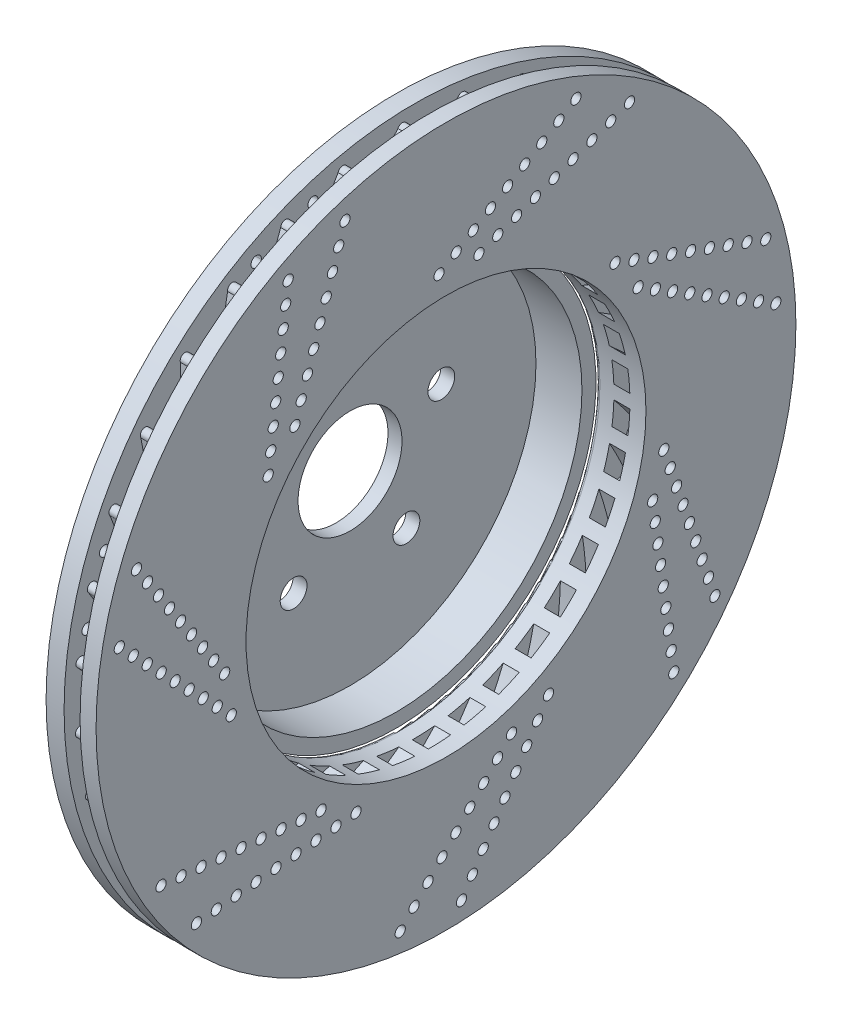
from build123d import *

# Parameters (mm, degrees)
SKETCH2_R           = 87.5
BOSS_EXTRUDE1_DEPTH = 4.5
SKETCH3_R           = 50
CUT_EXTRUDE1_DEPTH  = 124.82548203
SKETCH4_R           = 1.28
CUT_EXTRUDE6_DEPTH  = 124.82548203
CIRPATTERN1_COUNT   = 7
SKETCH6_R           = 87.5
SKETCH6_R_2         = 50
BOSS_EXTRUDE2_DEPTH = 4
SKETCH7_R           = 1.28
CUT_EXTRUDE8_DEPTH  = 13
CIRPATTERN3_COUNT   = 7
BOSS_EXTRUDE3_DEPTH = 7
SKETCH11_R          = 50
BOSS_EXTRUDE4_DEPTH = 15
SHELL1_T            = -3.5
FILLET1_R           = 1
SKETCH12_R          = 13
SKETCH12_R_2        = 3.35
CUT_EXTRUDE9_DEPTH  = 15


with BuildPart() as part:
    # Sketch2 → Boss-Extrude1 (new body)
    with BuildSketch(Plane(origin=(0, 0, 0), x_dir=(0, 0, -1), z_dir=(1, 0, 0))):
        Circle(SKETCH2_R)
    extrude(amount=BOSS_EXTRUDE1_DEPTH)

    # Sketch3 → Cut-Extrude1 (cut, through all)
    with BuildSketch(Plane(origin=(4.5, 0, 0), x_dir=(0, 0, -1), z_dir=(1, 0, 0))):
        Circle(SKETCH3_R)
    extrude(amount=-CUT_EXTRUDE1_DEPTH, mode=Mode.SUBTRACT)

    # Sketch4 → Cut-Extrude6 (cut, through all)
    with BuildSketch(Plane(origin=(4.5, 0, 0), x_dir=(0, 0, -1), z_dir=(1, 0, 0))):
        with Locations((-36.238967636, -45.409652022)):
            Circle(SKETCH4_R)
        with Locations((-31.238967636, -45.873487998)):
            Circle(SKETCH4_R)
        with Locations((-41.238967636, -44.945816046)):
            Circle(SKETCH4_R)
        with Locations((-46.238967636, -44.48198007)):
            Circle(SKETCH4_R)
        with Locations((-51.217591126, -44.020127132)):
            Circle(SKETCH4_R)
        with Locations((-56.217591126, -43.556291156)):
            Circle(SKETCH4_R)
        with Locations((-66.217591126, -42.628619204)):
            Circle(SKETCH4_R)
        with Locations((-61.217591126, -43.09245518)):
            Circle(SKETCH4_R)
        with Locations((-62.5, -54.727134355)):
            Circle(SKETCH4_R)
        with Locations((-57.5, -54.228068007)):
            Circle(SKETCH4_R)
        with Locations((-52.5, -53.72900166)):
            Circle(SKETCH4_R)
        with Locations((-47.5, -53.229935313)):
            Circle(SKETCH4_R)
        with Locations((-42.5, -52.730868965)):
            Circle(SKETCH4_R)
        with Locations((-37.5, -52.231802618)):
            Circle(SKETCH4_R)
        with Locations((-32.5, -51.732736271)):
            Circle(SKETCH4_R)
        with Locations((-27.5, -51.233669923)):
            Circle(SKETCH4_R)
        with Locations((-22.5, -50.734603576)):
            Circle(SKETCH4_R)
    cut_extrude6 = extrude(amount=-CUT_EXTRUDE6_DEPTH, mode=Mode.SUBTRACT)

    # CirPattern1: Cut-Extrude6 ×7 about axis
    cirpattern1_axis = Axis((0, 0, 0), (1, 0, 0))
    for i in range(1, CIRPATTERN1_COUNT):
        add(cut_extrude6.rotate(cirpattern1_axis, i * 360 / CIRPATTERN1_COUNT), mode=Mode.SUBTRACT)


with BuildPart() as body_2:
    # Sketch6 → Boss-Extrude2 (new body)
    with BuildSketch(Plane(origin=(8.5, 0, 0), x_dir=(0, 0, -1), z_dir=(1, 0, 0))):
        Circle(SKETCH6_R)
        Circle(SKETCH6_R_2, mode=Mode.SUBTRACT)
    extrude(amount=BOSS_EXTRUDE2_DEPTH)


with BuildPart() as cut_extrude8_tool:
    # Sketch7 → Cut-Extrude8 (new body)
    with BuildSketch(Plane(origin=(12.5, 0, 0), x_dir=(0, 0, -1), z_dir=(1, 0, 0))):
        with Locations((-71.238967636, -42.162800189)):
            Circle(SKETCH7_R)
        with Locations((-66.238967636, -42.626636165)):
            Circle(SKETCH7_R)
        with Locations((-61.238967636, -43.090472141)):
            Circle(SKETCH7_R)
        with Locations((-56.238967636, -43.554308117)):
            Circle(SKETCH7_R)
        with Locations((-51.238967636, -44.018144094)):
            Circle(SKETCH7_R)
        with Locations((-46.238967636, -44.48198007)):
            Circle(SKETCH7_R)
        with Locations((-41.238967636, -44.945816046)):
            Circle(SKETCH7_R)
        with Locations((-36.238967636, -45.409652022)):
            Circle(SKETCH7_R)
        with Locations((-31.238967636, -45.873487998)):
            Circle(SKETCH7_R)
        with Locations((-27.5, -51.233669923)):
            Circle(SKETCH7_R)
        with Locations((-32.5, -51.732736271)):
            Circle(SKETCH7_R)
        with Locations((-37.5, -52.231802618)):
            Circle(SKETCH7_R)
        with Locations((-47.47527785, -53.227467714)):
            Circle(SKETCH7_R)
        with Locations((-52.4505557, -53.724066463)):
            Circle(SKETCH7_R)
        with Locations((-57.425833549, -54.220665211)):
            Circle(SKETCH7_R)
        with Locations((-62.401111399, -54.71726396)):
            Circle(SKETCH7_R)
        with Locations((-22.5, -50.734603576)):
            Circle(SKETCH7_R)
        with Locations((-42.5, -52.730868965)):
            Circle(SKETCH7_R)
    cut_extrude8 = extrude(amount=-CUT_EXTRUDE8_DEPTH)


with BuildPart() as part_1:
    add(part.part)

    # Cut-Extrude8: cut by cut_extrude8_tool
    add(cut_extrude8_tool.part, mode=Mode.SUBTRACT)


with BuildPart() as body_2_1:
    add(body_2.part)

    # Cut-Extrude8: cut by cut_extrude8_tool
    add(cut_extrude8_tool.part, mode=Mode.SUBTRACT)


with BuildPart() as cirpattern3_tool:
    # CirPattern3: Cut-Extrude8 ×7 about axis
    cirpattern3_axis = Axis((0, 0, 0), (1, 0, 0))
    for i in range(1, CIRPATTERN3_COUNT):
        add(cut_extrude8.rotate(cirpattern3_axis, i * 360 / CIRPATTERN3_COUNT))


with BuildPart() as part_2:
    add(part_1.part)

    # CirPattern3: cut by cirpattern3_tool
    add(cirpattern3_tool.part, mode=Mode.SUBTRACT)



with BuildPart() as body_2_2:
    add(body_2_1.part)

    # CirPattern3: cut by cirpattern3_tool
    add(cirpattern3_tool.part, mode=Mode.SUBTRACT)


with BuildPart() as part_3:
    add(part_2.part)

    add(body_2_2.part)  # Boss-Extrude3 merges body 2
    # Sketch9 → Boss-Extrude3 (add)
    with BuildSketch(Plane.ZY.offset(-8.5)):
        with BuildLine():
            ThreePointArc((68.442168795, -47.350174225), (69.422712349, -48.739933197), (68.032953377, -49.720476751))
            add(Edge.make_bspline(
                [(17.953456701, -46.665548239), (42.503233131, -53.510207184), (68.032953377, -49.720476751)],
                knots=[0, 0, 0, 1, 1, 1], degree=2))
            ThreePointArc((17.953456701, -46.665548239), (19.526266784, -46.029609009), (21.076597054, -45.340677726))
            add(Edge.make_bspline(
                [(21.076597054, -45.340677726), (44.378084471, -52.109699667), (68.442168795, -47.350174225)],
                knots=[0, 0, 0, 1, 1, 1], degree=2))
        make_face()
        with BuildLine():
            ThreePointArc((9.332481879, -49.12132716), (10.99356759, -48.776443819), (12.641996845, -48.375406104))
            add(Edge.make_bspline(
                [(12.641996845, -48.375406104), (34.360364234, -59.196288315), (58.887574908, -58.810058579)],
                knots=[0, 0, 0, 1, 1, 1], degree=2))
            ThreePointArc((58.887574908, -58.810058579), (59.604209677, -60.352566364), (58.061701891, -61.069201133))
            add(Edge.make_bspline(
                [(9.332481879, -49.12132716), (32.265572254, -60.239521467), (58.061701891, -61.069201133)],
                knots=[0, 0, 0, 1, 1, 1], degree=2))
        make_face()
        with BuildLine():
            ThreePointArc((0.411553409, -49.998306209), (2.107526088, -49.955563592), (3.801072456, -49.855309127))
            add(Edge.make_bspline(
                [(3.801072456, -49.855309127), (23.23827362, -64.380259551), (47.44028591, -68.379739261)],
                knots=[0, 0, 0, 1, 1, 1], degree=2))
            ThreePointArc((47.44028591, -68.379739261), (47.869978663, -70.025418391), (46.224299533, -70.455111144))
            add(Edge.make_bspline(
                [(0.411553409, -49.998306209), (20.990869336, -65.032687965), (46.224299533, -70.455111144)],
                knots=[0, 0, 0, 1, 1, 1], degree=2))
        make_face()
        with BuildLine():
            ThreePointArc((-8.522602725, -49.268298558), (-6.846253036, -49.529070447), (-5.162021529, -49.732821494))
            add(Edge.make_bspline(
                [(-5.162021529, -49.732821494), (11.369285771, -67.494996272), (34.468227089, -75.75163886)],
                knots=[0, 0, 0, 1, 1, 1], degree=2))
            ThreePointArc((34.468227089, -75.75163886), (34.597167147, -77.447595853), (32.901210154, -77.576535911))
            add(Edge.make_bspline(
                [(-8.522602725, -49.268298558), (9.041502607, -67.735650363), (32.901210154, -77.576535911)],
                knots=[0, 0, 0, 1, 1, 1], degree=2))
        make_face()
        with BuildLine():
            ThreePointArc((-17.182835396, -46.954767253), (-15.579987954, -47.510672226), (-13.959203895, -48.011880057))
            add(Edge.make_bspline(
                [(-13.959203895, -48.011880057), (-0.865120277, -68.440388277), (20.388331088, -80.688818457)],
                knots=[0, 0, 0, 1, 1, 1], degree=2))
            ThreePointArc((20.388331088, -80.688818457), (20.212374213, -82.38054386), (18.52064881, -82.204586984))
            add(Edge.make_bspline(
                [(-17.182835396, -46.954767253), (-3.198465456, -68.261533225), (18.52064881, -82.204586984)],
                knots=[0, 0, 0, 1, 1, 1], degree=2))
        make_face()
        with BuildLine():
            ThreePointArc((-25.290797599, -43.132071094), (-23.812969241, -43.965241907), (-22.307725962, -44.747797291))
            add(Edge.make_bspline(
                [(-22.307725962, -44.747797291), (-13.071720648, -67.186049891), (5.653137351, -83.032593038)],
                knots=[0, 0, 0, 1, 1, 1], degree=2))
            ThreePointArc((5.653137351, -83.032593038), (5.17793894, -84.665713405), (3.544818574, -84.190514993))
            add(Edge.make_bspline(
                [(-25.290797599, -43.132071094), (-15.335632207, -66.593434243), (3.544818574, -84.190514993)],
                knots=[0, 0, 0, 1, 1, 1], degree=2))
        make_face()
        with BuildLine():
            ThreePointArc((-32.585892757, -37.92307468), (-31.280582102, -39.006732539), (-29.939259361, -40.045483502))
            add(Edge.make_bspline(
                [(-29.939259361, -40.045483502), (-24.858185162, -63.77229658), (-9.263752872, -82.70763176)],
                knots=[0, 0, 0, 1, 1, 1], degree=2))
            ThreePointArc((-9.263752872, -82.70763176), (-10.02291955, -84.229657257), (-11.544945047, -83.470490578))
            add(Edge.make_bspline(
                [(-32.585892757, -37.92307468), (-26.979899121, -62.784967492), (-11.544945047, -83.470490578)],
                knots=[0, 0, 0, 1, 1, 1], degree=2))
        make_face()
        with BuildLine():
            ThreePointArc((-38.833650511, -31.495199444), (-37.742811317, -32.794514692), (-36.608520331, -34.056074923))
            add(Edge.make_bspline(
                [(-36.608520331, -34.056074923), (-35.845687151, -58.308849185), (-23.882898455, -79.724379145)],
                knots=[0, 0, 0, 1, 1, 1], degree=2))
            ThreePointArc((-23.882898455, -79.724379145), (-24.901633159, -81.086390621), (-26.263644636, -80.067655917))
            add(Edge.make_bspline(
                [(-38.833650511, -31.495199444), (-37.757009878, -56.958540225), (-26.263644636, -80.067655917)],
                knots=[0, 0, 0, 1, 1, 1], degree=2))
        make_face()
        with BuildLine():
            ThreePointArc((-43.833262785, -24.055042583), (-42.991955522, -25.528254159), (-42.101153336, -26.972076075))
            add(Edge.make_bspline(
                [(-42.101153336, -26.972076075), (-45.681079262, -50.971307401), (-37.734428031, -74.178719386)],
                knots=[0, 0, 0, 1, 1, 1], degree=2))
            ThreePointArc((-37.734428031, -74.178719386), (-38.97998779, -75.336940672), (-40.138209076, -74.091380914))
            add(Edge.make_bspline(
                [(-43.833262785, -24.055042583), (-47.32057927, -49.301418611), (-40.138209076, -74.091380914)],
                knots=[0, 0, 0, 1, 1, 1], degree=2))
        make_face()
        with BuildLine():
            ThreePointArc((-47.424037926, -15.84173686), (-46.859302902, -17.441494533), (-46.240620632, -19.021172509))
            add(Edge.make_bspline(
                [(-46.240620632, -19.021172509), (-54.048243898, -41.995505857), (-50.373142042, -66.248894552)],
                knots=[0, 0, 0, 1, 1, 1], degree=2))
            ThreePointArc((-50.373142042, -66.248894552), (-51.80549354, -67.166099463), (-52.722698451, -65.733747966))
            add(Edge.make_bspline(
                [(-47.424037926, -15.84173686), (-55.36322631, -40.059708836), (-52.722698451, -65.733747966)],
                knots=[0, 0, 0, 1, 1, 1], degree=2))
        make_face()
        with BuildLine():
            ThreePointArc((-49.490565469, -7.119264681), (-49.220553731, -8.794150922), (-48.893876333, -10.458912808))
            add(Edge.make_bspline(
                [(-48.893876333, -10.458912808), (-60.678253504, -31.669934201), (-61.392821821, -56.189775737)],
                knots=[0, 0, 0, 1, 1, 1], degree=2))
            ThreePointArc((-61.392821821, -56.189775737), (-62.965928101, -56.836484553), (-63.612636917, -55.263378272))
            add(Edge.make_bspline(
                [(-49.490565469, -7.119264681), (-61.626453703, -29.530447059), (-63.612636917, -55.263378272)],
                knots=[0, 0, 0, 1, 1, 1], degree=2))
        make_face()
        with BuildLine():
            ThreePointArc((-49.966425516, 1.832026524), (-49.999815464, 0.135843936), (-49.975642619, -1.560495043))
            add(Edge.make_bspline(
                [(-49.975642619, -1.560495043), (-65.358014117, -20.326464802), (-70.439285793, -44.324671297)],
                knots=[0, 0, 0, 1, 1, 1], degree=2))
            ThreePointArc((-70.439285793, -44.324671297), (-72.102585926, -44.680098263), (-72.458012891, -43.01679813))
            add(Edge.make_bspline(
                [(-49.966425516, 1.832026524), (-65.908956168, -18.052052415), (-72.458012891, -43.01679813)],
                knots=[0, 0, 0, 1, 1, 1], degree=2))
        make_face()
        with BuildLine():
            ThreePointArc((-48.836323534, 10.724434888), (-49.172041988, 9.061472658), (-49.451150632, 7.388078316))
            add(Edge.make_bspline(
                [(-49.451150632, 7.388078316), (-67.937114379, -8.3296861), (-77.221773161, -31.034935451)],
                knots=[0, 0, 0, 1, 1, 1], degree=2))
            ThreePointArc((-77.221773161, -31.034935451), (-78.921807312, -31.087656853), (-78.974528713, -29.387622702))
            add(Edge.make_bspline(
                [(-48.836323534, 10.724434888), (-68.073090551, -5.993449953), (-78.974528713, -29.387622702)],
                knots=[0, 0, 0, 1, 1, 1], degree=2))
        make_face()
        with BuildLine():
            ThreePointArc((-46.136581932, 19.272151091), (-46.763838624, 17.695858193), (-47.337257974, 16.099192759))
            add(Edge.make_bspline(
                [(-47.337257974, 16.099192759), (-68.332659886, 3.934815568), (-81.522289202, -16.747711244)],
                knots=[0, 0, 0, 1, 1, 1], degree=2))
            ThreePointArc((-81.522289202, -16.747711244), (-83.204416874, -16.496032572), (-82.952738202, -14.8139049))
            add(Edge.make_bspline(
                [(-46.136581932, 19.272151091), (-68.049299793, 6.257786921), (-82.952738202, -14.8139049)],
                knots=[0, 0, 0, 1, 1, 1], degree=2))
        make_face()
        with BuildLine():
            ThreePointArc((-41.953972624, 27.200444501), (-42.852607009, 25.761484285), (-43.701906896, 24.2928659))
            add(Edge.make_bspline(
                [(-43.701906896, 24.2928659), (-66.53193748, 16.072849026), (-83.202611791, -1.922201818)],
                knots=[0, 0, 0, 1, 1, 1], degree=2))
            ThreePointArc((-83.202611791, -1.922201818), (-84.812768017, -1.374212232), (-84.264778431, 0.235943995))
            add(Edge.make_bspline(
                [(-41.953972624, 27.200444501), (-65.838348549, 18.307893375), (-84.264778431, 0.235943995)],
                knots=[0, 0, 0, 1, 1, 1], degree=2))
        make_face()
        with BuildLine():
            ThreePointArc((-36.422928117, 34.254493243), (-37.564057345, 32.999115076), (-38.661940573, 31.705746343))
            add(Edge.make_bspline(
                [(-38.661940573, 31.705746343), (-62.592823861, 27.694287891), (-82.208733977, 12.965088756)],
                knots=[0, 0, 0, 1, 1, 1], degree=2))
            ThreePointArc((-82.208733977, 12.965088756), (-83.695167012, 13.79177642), (-82.868479348, 15.278209455))
            add(Edge.make_bspline(
                [(-36.422928117, 34.254493243), (-61.51129861, 29.769569073), (-82.868479348, 15.278209455)],
                knots=[0, 0, 0, 1, 1, 1], degree=2))
        make_face()
        with BuildLine():
            ThreePointArc((-29.721220732, 40.207574389), (-31.068167971, 39.176127156), (-32.379347668, 38.099578011))
            add(Edge.make_bspline(
                [(-32.379347668, 38.099578011), (-56.641925381, 38.425609556), (-78.572599812, 27.435670711)],
                knots=[0, 0, 0, 1, 1, 1], degree=2))
            ThreePointArc((-78.572599812, 27.435670711), (-79.887534474, 28.514486031), (-78.808719154, 29.829420693))
            add(Edge.make_bspline(
                [(-29.721220732, 40.207574389), (-55.207224923, 40.274426325), (-78.808719154, 29.829420693)],
                knots=[0, 0, 0, 1, 1, 1], degree=2))
        make_face()
        with BuildLine():
            ThreePointArc((-22.064248857, 44.86835101), (-23.573722115, 44.093986275), (-25.056055887, 43.268857893))
            add(Edge.make_bspline(
                [(-25.056055887, 43.268857893), (-48.870508815, 47.921900514), (-72.41107764, 41.024447634)],
                knots=[0, 0, 0, 1, 1, 1], degree=2))
            ThreePointArc((-72.41107764, 41.024447634), (-73.512250847, 42.320716598), (-72.215981883, 43.421889805))
            add(Edge.make_bspline(
                [(-22.064248857, 44.86835101), (-47.128745602, 49.484830378), (-72.215981883, 43.421889805)],
                knots=[0, 0, 0, 1, 1, 1], degree=2))
        make_face()
        with BuildLine():
            ThreePointArc((-13.698113869, 48.087021913), (-15.321597433, 47.594628395), (-16.927441854, 47.047441081))
            add(Edge.make_bspline(
                [(-16.927441854, 47.047441081), (-39.528353884, 55.877942158), (-63.922203852, 53.294665055)],
                knots=[0, 0, 0, 1, 1, 1], degree=2))
            ThreePointArc((-63.922203852, 53.294665055), (-64.774222991, 54.766724512), (-63.302163534, 55.618743652))
            add(Edge.make_bspline(
                [(-13.698113869, 48.087021913), (-37.535509619, 57.104751266), (-63.302163534, 55.618743652)],
                knots=[0, 0, 0, 1, 1, 1], degree=2))
        make_face()
        with BuildLine():
            ThreePointArc((-4.891710231, 49.760136365), (-6.577024004, 49.565539998), (-8.254765912, 49.313880802))
            add(Edge.make_bspline(
                [(-8.254765912, 49.313880802), (-28.915725136, 62.038020766), (-53.378817836, 63.851948091)],
                knots=[0, 0, 0, 1, 1, 1], degree=2))
            ThreePointArc((-53.378817836, 63.851948091), (-53.954298312, 65.452484839), (-52.353761564, 66.027965315))
            add(Edge.make_bspline(
                [(-4.891710231, 49.760136365), (-26.735851473, 62.889278462), (-52.353761564, 66.027965315)],
                knots=[0, 0, 0, 1, 1, 1], degree=2))
        make_face()
        with BuildLine():
            ThreePointArc((4.071916999, 49.833919091), (2.378940388, 49.943374362), (0.683224999, 49.995331818))
            add(Edge.make_bspline(
                [(0.683224999, 49.995331818), (-17.373721189, 66.204146341), (-41.119792696, 72.356976977)],
                knots=[0, 0, 0, 1, 1, 1], degree=2))
            ThreePointArc((-41.119792696, 72.356976977), (-41.400238092, 74.034548448), (-39.722666621, 74.314993844))
            add(Edge.make_bspline(
                [(4.071916999, 49.833919091), (-15.076881062, 66.652492504), (-39.722666621, 74.314993844)],
                knots=[0, 0, 0, 1, 1, 1], degree=2))
        make_face()
        with BuildLine():
            ThreePointArc((12.904669466, 48.305998654), (11.25844368, 48.71598758), (9.599256496, 49.069891733))
            add(Edge.make_bspline(
                [(9.599256496, 49.069891733), (-5.273311549, 68.242416179), (-27.539143584, 78.536393088)],
                knots=[0, 0, 0, 1, 1, 1], degree=2))
            ThreePointArc((-27.539143584, 78.536393088), (-27.515540155, 80.237080754), (-25.814852489, 80.213477325))
            add(Edge.make_bspline(
                [(12.904669466, 48.305998654), (-2.933327289, 68.273440594), (-25.814852489, 80.213477325)],
                knots=[0, 0, 0, 1, 1, 1], degree=2))
        make_face()
        with BuildLine():
            ThreePointArc((21.322655238, 45.225483674), (19.776091327, 45.922828874), (18.206759991, 46.567304953))
            add(Edge.make_bspline(
                [(18.206759991, 46.567304953), (6.996586664, 68.087318612), (-13.073363739, 82.191584905)],
                knots=[0, 0, 0, 1, 1, 1], degree=2))
            ThreePointArc((-13.073363739, 82.191584905), (-12.746470118, 83.860727266), (-11.077327757, 83.533833644))
            add(Edge.make_bspline(
                [(21.322655238, 45.225483674), (9.304506037, 67.700024128), (-11.077327757, 83.533833644)],
                knots=[0, 0, 0, 1, 1, 1], degree=2))
        make_face()
        with BuildLine():
            ThreePointArc((29.055313327, 40.691384438), (27.658119128, 41.653672663), (26.229083239, 42.568006677))
            add(Edge.make_bspline(
                [(26.229083239, 42.568006677), (19.041608824, 65.743838601), (1.812604774, 83.205071555)],
                knots=[0, 0, 0, 1, 1, 1], degree=2))
            ThreePointArc((1.812604774, 83.205071555), (2.432281957, 84.789021002), (4.016231404, 84.169343819))
            add(Edge.make_bspline(
                [(29.055313327, 40.691384438), (21.243284883, 64.950673183), (4.016231404, 84.169343819)],
                knots=[0, 0, 0, 1, 1, 1], degree=2))
        make_face()
        with BuildLine():
            ThreePointArc((35.854109739, 34.849430624), (34.651192223, 36.045733139), (33.408382171, 37.20053764))
            add(Edge.make_bspline(
                [(33.408382171, 37.20053764), (30.474618009, 61.287297524), (16.640314678, 81.544278745)],
                knots=[0, 0, 0, 1, 1, 1], degree=2))
            ThreePointArc((16.640314678, 81.544278745), (17.532858488, 82.992125838), (18.980705582, 82.099582028))
            add(Edge.make_bspline(
                [(35.854109739, 34.849430624), (32.499287074, 60.11375416), (18.980705582, 82.099582028)],
                knots=[0, 0, 0, 1, 1, 1], degree=2))
        make_face()
        with BuildLine():
            ThreePointArc((41.500525563, 27.887387436), (40.530547488, 29.279254094), (39.513908211, 30.637412715))
            add(Edge.make_bspline(
                [(39.513908211, 30.637412715), (40.928147897, 54.860932278), (30.933191177, 77.262585721)],
                knots=[0, 0, 0, 1, 1, 1], degree=2))
            ThreePointArc((30.933191177, 77.262585721), (32.069914522, 78.527795464), (33.335124266, 77.391072119))
            add(Edge.make_bspline(
                [(41.500525563, 27.887387436), (42.710735438, 53.344729616), (33.335124266, 77.391072119)],
                knots=[0, 0, 0, 1, 1, 1], degree=2))
        make_face()
        with BuildLine():
            ThreePointArc((45.813080348, 20.02902067), (45.107217609, 21.571715731), (44.349424729, 23.089576137))
            add(Edge.make_bspline(
                [(44.349424729, 23.089576137), (50.066213436, 46.671291528), (44.231849459, 70.497609619)],
                knots=[0, 0, 0, 1, 1, 1], degree=2))
            ThreePointArc((44.231849459, 70.497609619), (45.576217116, 71.539517131), (46.618124628, 70.195149475))
            add(Edge.make_bspline(
                [(45.813080348, 20.02902067), (51.549425623, 44.861161571), (46.618124628, 70.195149475)],
                knots=[0, 0, 0, 1, 1, 1], degree=2))
        make_face()
        with BuildLine():
            ThreePointArc((48.653165036, 11.5269047), (48.234104641, 13.170844676), (47.759514246, 14.799621584))
            add(Edge.make_bspline(
                [(47.759514246, 14.799621584), (57.59510968, 36.981597067), (56.108859705, 61.466782339)],
                knots=[0, 0, 0, 1, 1, 1], degree=2))
            ThreePointArc((56.108859705, 61.466782339), (57.617662591, 62.251899855), (58.402780106, 60.743096969))
            add(Edge.make_bspline(
                [(48.653165036, 11.5269047), (58.731274852, 34.935718881), (58.402780106, 60.743096969)],
                knots=[0, 0, 0, 1, 1, 1], degree=2))
        make_face()
        with BuildLine():
            ThreePointArc((49.929496968, 2.654304528), (49.810707863, 4.346651835), (49.634573678, 6.033995016))
            add(Edge.make_bspline(
                [(49.634573678, 6.033995016), (63.27285171, 26.103283648), (66.182485034, 50.4603621)],
                knots=[0, 0, 0, 1, 1, 1], degree=2))
            ThreePointArc((66.182485034, 50.4603621), (67.807228982, 50.963455296), (68.310322178, 49.338711348))
            add(Edge.make_bspline(
                [(49.929496968, 2.654304528), (64.025452584, 23.88741344), (68.310322178, 49.338711348)],
                knots=[0, 0, 0, 1, 1, 1], degree=2))
        make_face()
        with BuildLine():
            ThreePointArc((49.601053785, -6.303607175), (49.78635395, -4.617245972), (49.914337072, -2.925569117))
            add(Edge.make_bspline(
                [(49.914337072, -2.925569117), (66.916952224, 14.385989214), (74.128950839, 37.832104304)],
                knots=[0, 0, 0, 1, 1, 1], degree=2))
            ThreePointArc((74.128950839, 37.832104304), (75.817415242, 38.037003351), (76.022314289, 36.348538948))
            add(Edge.make_bspline(
                [(49.601053785, -6.303607175), (67.26179959, 12.071346878), (76.022314289, 36.348538948)],
                knots=[0, 0, 0, 1, 1, 1], degree=2))
        make_face()
        with BuildLine():
            ThreePointArc((47.678391922, -15.058915757), (48.161825657, -13.432741694), (48.589812603, -11.791103052))
            add(Edge.make_bspline(
                [(48.589812603, -11.791103052), (68.410286835, 2.20631725), (79.692851171, 23.987891547)],
                knots=[0, 0, 0, 1, 1, 1], degree=2))
            ThreePointArc((79.692851171, 23.987891547), (81.390767394, 23.888010821), (81.290886668, 22.190094598))
            add(Edge.make_bspline(
                [(47.678391922, -15.058915757), (68.336297013, -0.132702706), (81.290886668, 22.190094598)],
                knots=[0, 0, 0, 1, 1, 1], degree=2))
        make_face()
        with BuildLine():
            ThreePointArc((44.223307312, -23.330218396), (44.989336659, -21.816498046), (45.703571578, -20.277661232))
            add(Edge.make_bspline(
                [(45.703571578, -20.277661232), (67.704858539, -10.044267565), (82.695357694, 9.372688218)],
                knots=[0, 0, 0, 1, 1, 1], degree=2))
            ThreePointArc((82.695357694, 9.372688218), (84.348153313, 8.971237969), (83.946703063, 7.31844235))
            add(Edge.make_bspline(
                [(44.223307312, -23.330218396), (67.214409624, -12.332487116), (83.946703063, 7.31844235)],
                knots=[0, 0, 0, 1, 1, 1], degree=2))
        make_face()
        with BuildLine():
            ThreePointArc((39.346849218, -30.85166862), (40.370853364, -29.4990542), (41.348380157, -28.112478696))
            add(Edge.make_bspline(
                [(41.348380157, -28.112478696), (64.823340381, -21.972021356), (83.039967379, -5.543761021)],
                knots=[0, 0, 0, 1, 1, 1], degree=2))
            ThreePointArc((83.039967379, -5.543761021), (84.594520182, -6.233877854), (83.90440335, -7.788430657))
            add(Edge.make_bspline(
                [(39.346849218, -30.85166862), (63.932195804, -24.135895242), (83.90440335, -7.788430657)],
                knots=[0, 0, 0, 1, 1, 1], degree=2))
        make_face()
        with BuildLine():
            ThreePointArc((33.205751016, -37.381520829), (34.454817624, -36.23348648), (35.664217776, -35.043737963))
            add(Edge.make_bspline(
                [(35.664217776, -35.043737963), (59.858346727, -33.193576303), (80.715604187, -20.28202922)],
                knots=[0, 0, 0, 1, 1, 1], degree=2))
            ThreePointArc((80.715604187, -20.28202922), (82.121949568, -21.238631713), (81.165347076, -22.644977094))
            add(Edge.make_bspline(
                [(33.205751016, -37.381520829), (58.595148608, -35.163555837), (81.165347076, -22.644977094)],
                knots=[0, 0, 0, 1, 1, 1], degree=2))
        make_face()
        with BuildLine():
            ThreePointArc((25.997392654, -42.709900201), (27.431375697, -41.803344691), (28.833778091, -40.848662659))
            add(Edge.make_bspline(
                [(28.833778091, -40.848662659), (52.969456557, -43.348262395), (75.796975064, -34.368416312)],
                knots=[0, 0, 0, 1, 1, 1], degree=2))
            ThreePointArc((75.796975064, -34.368416312), (77.009911925, -35.560758473), (75.817569764, -36.773695335))
            add(Edge.make_bspline(
                [(25.997392654, -42.709900201), (51.374805124, -45.061030814), (75.817569764, -36.773695335)],
                knots=[0, 0, 0, 1, 1, 1], degree=2))
        make_face()
    extrude(amount=BOSS_EXTRUDE3_DEPTH)

    # Fillet1
    fillet1_edges = [part_3.edges().sort_by_distance(p)[0] for p in [
        (0, 0, 50),
    ]]
    fillet(fillet1_edges, radius=FILLET1_R)


with BuildPart() as body_2_2_1:
    # Sketch11 → Boss-Extrude4 (new body)
    with BuildSketch(Plane.ZY):
        Circle(SKETCH11_R)
    extrude(amount=BOSS_EXTRUDE4_DEPTH)

    # Shell1
    shell1_openings = [body_2_2_1.faces().sort_by_distance(p)[0] for p in [
        (0, 0, 0),
    ]]
    offset(amount=SHELL1_T, openings=shell1_openings, kind=Kind.INTERSECTION)

    # Sketch12 → Cut-Extrude9 (cut)
    with BuildSketch(Plane.ZY.offset(15)):
        Circle(SKETCH12_R)
        with Locations((0, 24)):
            Circle(SKETCH12_R_2)
        with Locations((22.825356391, 7.416407865)):
            Circle(SKETCH12_R_2)
        with Locations((14.106846055, -19.416407865)):
            Circle(SKETCH12_R_2)
        with Locations((-14.106846055, -19.416407865)):
            Circle(SKETCH12_R_2)
        with Locations((-22.825356391, 7.416407865)):
            Circle(SKETCH12_R_2)
    extrude(amount=-CUT_EXTRUDE9_DEPTH, mode=Mode.SUBTRACT)


solid = Compound([part_3.part, body_2_2_1.part])
